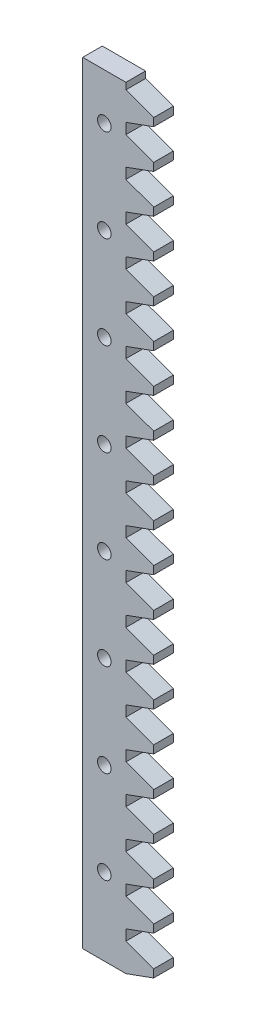
from build123d import *

# Parameters (mm, degrees)
SKETCH2_R           = 1.1
BOSS_EXTRUDE1_DEPTH = 3.175


with BuildPart() as part:
    # Sketch2 → Boss-Extrude1 (new body)
    with BuildSketch(Plane.XY):
        Polygon((3.5, -62.5), (8, -60.862133946), (8, -59.578422233), (3.5, -57.940556179), (3.5, -56.2168147), (8, -54.578948646), (8, -53.295236933), (3.5, -51.657370879), (3.5, -49.9336294), (8, -48.295763346), (8, -47.012051633), (3.5, -45.374185579), (3.5, -43.6504441), (8, -42.012578046), (8, -40.728866333), (3.5, -39.091000279), (3.5, -37.3672588), (8, -35.729392746), (8, -34.445681033), (3.5, -32.807814979), (3.5, -31.0840735), (8, -29.446207446), (8, -28.162495733), (3.5, -26.524629679), (3.5, -24.8008882), (8, -23.163022146), (8, -21.879310433), (3.5, -20.241444379), (3.5, -18.5177029), (8, -16.879836846), (8, -15.596125133), (3.5, -13.958259079), (3.5, -12.2345176), (8, -10.596651546), (8, -9.312939833), (3.5, -7.675073779), (3.5, -5.9513323), (8, -4.313466246), (8, -3.029754533), (3.5, -1.391888479), (3.5, 0.331853), (8, 1.969719054), (8, 3.253430767), (3.5, 4.891296821), (3.5, 6.6150383), (8, 8.252904354), (8, 9.536616067), (3.5, 11.174482121), (3.5, 12.8982236), (8, 14.536089654), (8, 15.819801367), (3.5, 17.457667421), (3.5, 19.1814089), (8, 20.819274954), (8, 22.102986667), (3.5, 23.740852721), (3.5, 25.4645942), (8, 27.102460254), (8, 28.386171967), (3.5, 30.024038021), (3.5, 31.7477795), (8, 33.385645554), (8, 34.669357267), (3.5, 36.307223321), (3.5, 38.0309648), (8, 39.668830854), (8, 40.952542567), (3.5, 42.590408621), (3.5, 44.3141501), (8, 45.952016154), (8, 47.235727867), (3.5, 48.873593921), (3.5, 50.5973354), (8, 52.235201454), (8, 53.518913167), (3.5, 55.156779221), (3.5, 56.8805207), (8, 58.518386754), (8, 59.802098467), (3.5, 61.439964521), (3.5, 62.5), (-3.5, 62.5), (-3.5, -62.5), align=None)
        with Locations((0, -50)):
            Circle(SKETCH2_R, mode=Mode.SUBTRACT)
        with Locations((0, -35)):
            Circle(SKETCH2_R, mode=Mode.SUBTRACT)
        with Locations((0, -20)):
            Circle(SKETCH2_R, mode=Mode.SUBTRACT)
        with Locations((0, -5)):
            Circle(SKETCH2_R, mode=Mode.SUBTRACT)
        with Locations((0, 10)):
            Circle(SKETCH2_R, mode=Mode.SUBTRACT)
        with Locations((0, 25)):
            Circle(SKETCH2_R, mode=Mode.SUBTRACT)
        with Locations((0, 40)):
            Circle(SKETCH2_R, mode=Mode.SUBTRACT)
        with Locations((0, 55)):
            Circle(SKETCH2_R, mode=Mode.SUBTRACT)
    extrude(amount=BOSS_EXTRUDE1_DEPTH)


solid = part.part
